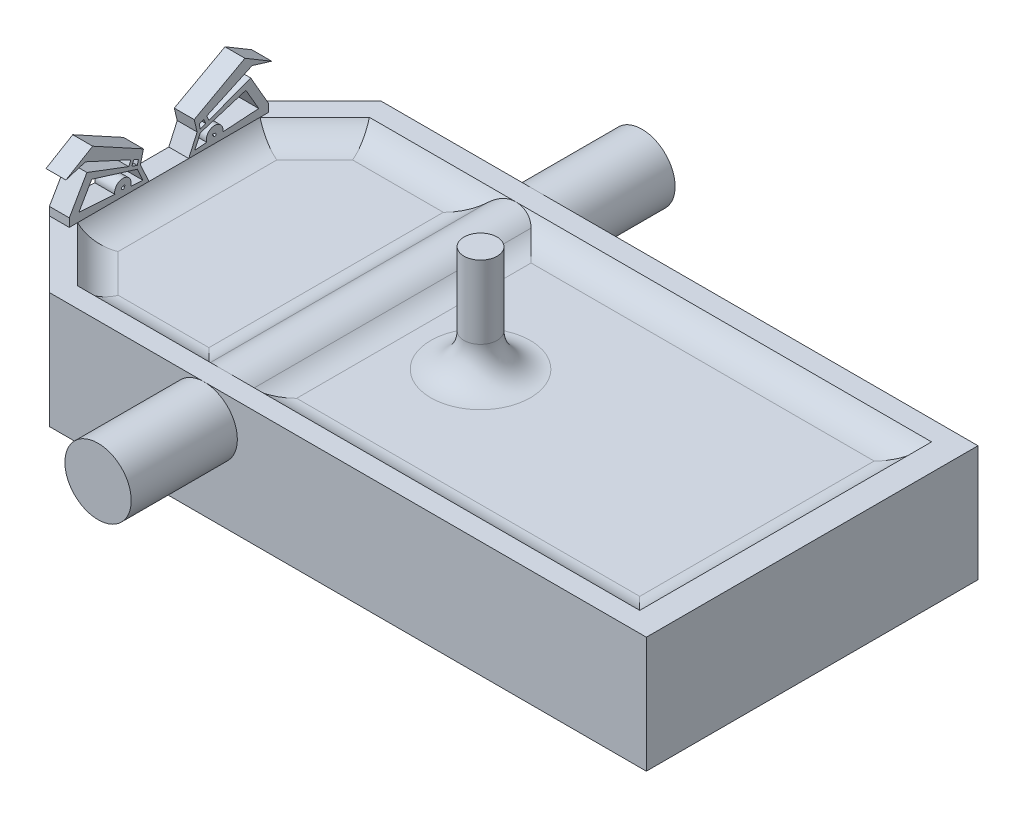
from build123d import *

# Parameters (mm, degrees)
SALIENTE_EXTRUIR1_DEPTH       = 5
CROQUIS2_R                    = 5
SALIENTE_EXTRUIR2_DEPTH       = 41
CROQUIS3_R                    = 2.5
SALIENTE_EXTRUIR3_DEPTH       = 16
SALIENTE_EXTRUIR10_DEPTH      = 10
SALIENTE_EXTRUIR10_DEPTH_BACK = 7.5
REDONDEO3_R                   = 5
SALIENTE_EXTRUIR11_DEPTH      = 3
CORTAR_EXTRUIR1_DEPTH         = 3


with BuildPart() as part:
    # Croquis1 → Saliente-Extruir1 (new body)
    with BuildSketch(Plane(origin=(0, 0, 0), x_dir=(1, 0, 0), z_dir=(0, 1, 0))):
        Polygon((-50, 15), (-40, 25), (50, 25), (50, -25), (-40, -25), (-50, -15), align=None)
    extrude(amount=SALIENTE_EXTRUIR1_DEPTH)

    # Croquis2 → Saliente-Extruir2 (add, symmetric)
    with BuildSketch(Plane.XY):
        with Locations((-16.666666667, 2.5)):
            Circle(CROQUIS2_R)
    extrude(amount=SALIENTE_EXTRUIR2_DEPTH, both=True)

    # Croquis3 → Saliente-Extruir3 (add)
    with BuildSketch(Plane(origin=(0, 5, 0), x_dir=(1, 0, 0), z_dir=(0, 1, 0))):
        with Locations(Location((0, 0, 0), (0, 0, 270))):
            Circle(CROQUIS3_R)
    extrude(amount=SALIENTE_EXTRUIR3_DEPTH)

    # Croquis24 → Saliente-Extruir10 (add, two sides: drawn at the far end of the back side and taken through both)
    with BuildSketch(Plane.XZ.offset(-SALIENTE_EXTRUIR10_DEPTH_BACK)):
        Polygon((50, 25), (-40, 25), (-50, 15), (-50, -15), (-40, -25), (50, -25), align=None)
        Polygon((46, 22), (-38.757359313, 22), (-47, 13.757359313), (-47, -13.757359313), (-38.757359313, -22), (46, -22), align=None, mode=Mode.SUBTRACT)
    extrude(amount=SALIENTE_EXTRUIR10_DEPTH + SALIENTE_EXTRUIR10_DEPTH_BACK)

    # Redondeo3
    # the kernel refuses this fillet: 5 mm, written as the material it adds along each edge
    with BuildSketch(Plane(origin=(46, 5, -22), x_dir=(0, 0, 1), z_dir=(-1, 0, 0)), Plane(origin=(-23.161857195, 5, 22), x_dir=(0, 0, -1), z_dir=(1, 0, 0))) as redondeo3_piece_1:
        with BuildLine():
            CenterArc((4.330127019, 5), REDONDEO3_R, 210, 60)
            Line((0, 2.5), (0, 0))
            Line((0, 0), (4.330127019, 0))
        make_face()
    extrude(amount=69.161857195)
    with BuildSketch(Plane(origin=(46, 5, 22), x_dir=(-1, 0, 0), z_dir=(0, 0, -1))) as redondeo3_piece_2:
        with BuildLine():
            CenterArc((4.330127019, 5), REDONDEO3_R, 210, 60)
            Line((0, 2.5), (0, 0))
            Line((0, 0), (4.330127019, 0))
        make_face()
    extrude(amount=44)
    with BuildSketch(Plane(origin=(-20.996793686, 5, -22), x_dir=(-1, 0, 0), z_dir=(0, 0, 1))) as redondeo3_piece_3:
        with BuildLine():
            CenterArc((2.284251259, -5), REDONDEO3_R, 90, 41.409622109)
            ThreePointArc((-1.02293788, -1.25), (-0.460660063, -0.66657946), (0, 0))
            Line((0, 0), (2.284251259, 0))
        make_face()
    extrude(amount=44)
    with BuildSketch(Plane(origin=(-12.336539648, 5, -22), x_dir=(-0.6333158920043388, 0.7738933911946454, 0), z_dir=(0, 0, 1))) as redondeo3_piece_4:
        with BuildLine():
            CenterArc((2.422814332, -4.934346413), REDONDEO3_R, 99.295188945, 41.409622109)
            Line((-1.446652623, -1.767766953), (0, 0))
            ThreePointArc((0, 0), (0.807604777, -0.065653587), (1.615209555, 0))
        make_face()
    extrude(amount=44)
    with BuildSketch(Plane(origin=(-49.58267686, 5, 22), x_dir=(0, 0, -1), z_dir=(1, 0, 0))) as redondeo3_piece_5_section:
        with BuildLine():
            CenterArc((4.330127019, 5), REDONDEO3_R, 210, 60)
            Line((0, 2.5), (0, 0))
            Line((0, 0), (4.330127019, 0))
        make_face()
    redondeo3_piece_5 = extrude(amount=39.411200722, mode=Mode.PRIVATE)
    redondeo3_piece_5 = split(redondeo3_piece_5, bisect_by=Plane(origin=(-35.229781416, 5.661212727, 25.527577897), z_dir=(0.7071067811865477, 0, -0.7071067811865475)), keep=Keep.TOP, mode=Mode.PRIVATE)
    add(redondeo3_piece_5)
    with BuildSketch(Plane(origin=(-54.654655446, 5, 6.102703867), x_dir=(0, 1, 0), z_dir=(0.7071067811865475, 0, 0.7071067811865477))) as redondeo3_piece_6_section:
        with BuildLine():
            CenterArc((5, -4.330127019), REDONDEO3_R, 120, 60)
            Line((0, -4.330127019), (0, 0))
            Line((0, 0), (2.5, 0))
        make_face()
    redondeo3_piece_6 = extrude(amount=33.307489344, mode=Mode.PRIVATE)
    redondeo3_piece_6 = split(redondeo3_piece_6, bisect_by=Plane(origin=(-47, 5.661212727, 16.588119965), z_dir=(1, 0, 0)), keep=Keep.TOP, mode=Mode.PRIVATE)
    redondeo3_piece_6 = split(redondeo3_piece_6, bisect_by=Plane(origin=(-41.588119965, 5.661212727, 22), z_dir=(0, 0, -1)), keep=Keep.TOP, mode=Mode.PRIVATE)
    add(redondeo3_piece_6)
    with BuildSketch(Plane(origin=(-47, 5, -24.58267686), x_dir=(1, 0, 0), z_dir=(0, 0, 1))) as redondeo3_piece_7_section:
        with BuildLine():
            CenterArc((4.330127019, 5), REDONDEO3_R, 210, 60)
            Line((0, 2.5), (0, 0))
            Line((0, 0), (4.330127019, 0))
        make_face()
    redondeo3_piece_7 = extrude(amount=49.16535372, mode=Mode.PRIVATE)
    redondeo3_piece_7 = split(redondeo3_piece_7, bisect_by=Plane(origin=(-52.966116147, 5.661212727, 7.791243166), z_dir=(0.7071067811865477, 0, -0.7071067811865475)), keep=Keep.TOP, mode=Mode.PRIVATE)
    redondeo3_piece_7 = split(redondeo3_piece_7, bisect_by=Plane(origin=(-52.966116147, 5.661212727, -7.791243166), z_dir=(0.7071067811865477, 0, 0.7071067811865474)), keep=Keep.TOP, mode=Mode.PRIVATE)
    add(redondeo3_piece_7)
    with BuildSketch(Plane(origin=(-31.102703867, 5, -29.654655446), x_dir=(0.7071067811865478, 0, 0.7071067811865474), z_dir=(-0.7071067811865474, 0, 0.7071067811865477))) as redondeo3_piece_8_section:
        with BuildLine():
            CenterArc((4.330127019, 5), REDONDEO3_R, 210, 60)
            Line((0, 2.5), (0, 0))
            Line((0, 0), (4.330127019, 0))
        make_face()
    redondeo3_piece_8 = extrude(amount=33.307489344, mode=Mode.PRIVATE)
    redondeo3_piece_8 = split(redondeo3_piece_8, bisect_by=Plane(origin=(-47, 5.661212727, -16.588119965), z_dir=(1, 0, 0)), keep=Keep.TOP, mode=Mode.PRIVATE)
    redondeo3_piece_8 = split(redondeo3_piece_8, bisect_by=Plane(origin=(-41.588119965, 5.661212727, -22), z_dir=(0, 0, 1)), keep=Keep.TOP, mode=Mode.PRIVATE)
    add(redondeo3_piece_8)
    with BuildSketch(Plane(origin=(-10.171476138, 5, -22), x_dir=(0, 0, 1), z_dir=(-1, 0, 0))) as redondeo3_piece_9_section:
        with BuildLine():
            CenterArc((4.330127019, 5), REDONDEO3_R, 210, 60)
            Line((0, 2.5), (0, 0))
            Line((0, 0), (4.330127019, 0))
        make_face()
    redondeo3_piece_9 = extrude(amount=39.411200722, mode=Mode.PRIVATE)
    redondeo3_piece_9 = split(redondeo3_piece_9, bisect_by=Plane(origin=(-26.735758427, 5.066113157, -34.021600886), z_dir=(0.7071067811865477, 0, 0.7071067811865474)), keep=Keep.TOP, mode=Mode.PRIVATE)
    add(redondeo3_piece_9)
    with BuildSketch(Plane(origin=(0, 5, 0), x_dir=(0, 0, 1), z_dir=(-1, 0, 0))) as redondeo3_piece_10:
        with BuildLine():
            CenterArc((2.5 + REDONDEO3_R, REDONDEO3_R), REDONDEO3_R, 180, 90)
            Line((2.5, REDONDEO3_R), (2.5, 0))
            Line((2.5, 0), (2.5 + REDONDEO3_R, 0))
        make_face()
    revolve(axis=Axis((0, 5, 0), (0, 1, 0)))

    # Croquis25 → Saliente-Extruir11 (add)
    # profile 1 of 2: a face of its own
    with BuildSketch(Plane.ZY.offset(50)):
        Polygon((-3, 7.5), (-4.271961203, 10.321467355), (-3.825834184, 12.171467355), (-11.478733088, 16.349678992), (-15.514093965, 13.949275268), (-12.566054552, 14.849678992), (-5.713025242, 11.692794832), (-6.047742661, 10.966183347), (-12.344374095, 13.349678992), (-15, 8.75), (-15, 7.5), align=None)
        Polygon((-5.258893064, 11.483596445), (-4.581316792, 11.171467355), (-4.749343557, 10.474693788), (-5.578981907, 10.788740976), align=None, mode=Mode.SUBTRACT)
        with BuildLine():
            Line((-13.556624327, 8.75), (-11.622686259, 12.099678992))
            Line((-11.622686259, 12.099678992), (-4.749343557, 9.974693788))
            Line((-4.749343557, 9.974693788), (-3.915472936, 8.125))
            Line((-3.915472936, 8.125), (-5.723760223, 8.242224542))
            ThreePointArc((-5.723760223, 8.242224542), (-6.834609816, 9.866860567), (-8.145918644, 8.399244067))
            Line((-8.145918644, 8.399244067), (-13.556624327, 8.75))
        make_face(mode=Mode.SUBTRACT)
        with BuildLine():
            ThreePointArc((-6.85573604, 8.822987446), (-7.052684855, 8.457747166), (-6.724418166, 8.711578367))
            add(Edge.make_bspline(
                [(-6.724418166, 8.711578367), (-6.676833807, 8.722274165), (-6.55662927, 8.681929546), (-6.577709986, 8.898272332), (-6.753765056, 8.872588077), (-6.835537659, 8.837673257), (-6.85573604, 8.822987446)],
                knots=[0, 0, 0, 0, 0.159221348, 0.274521525, 0.50339388, 0.587777767, 0.587777767, 0.587777767, 0.587777767], degree=3))
        make_face(mode=Mode.SUBTRACT)
    # profile 2 of 2: a face of its own
    with BuildSketch(Plane.ZY.offset(50)):
        Polygon((15, 7.5), (3, 7.5), (4.271961203, 10.321467355), (3.825834184, 12.171467355), (11.478733088, 16.349678992), (15.514093965, 13.949275268), (12.566054552, 14.849678992), (5.713025242, 11.692794832), (6.047742661, 10.966183347), (12.344374095, 13.349678992), (15, 8.75), align=None)
        Polygon((5.258893064, 11.483596445), (4.581316792, 11.171467355), (4.749343557, 10.474693788), (5.578981907, 10.788740976), align=None, mode=Mode.SUBTRACT)
        with BuildLine():
            Line((3.915472936, 8.125), (5.723760223, 8.242224542))
            ThreePointArc((5.723760223, 8.242224542), (6.834609816, 9.866860567), (8.145918644, 8.399244067))
            Line((8.145918644, 8.399244067), (13.556624327, 8.75))
            Line((13.556624327, 8.75), (11.622686259, 12.099678992))
            Line((11.622686259, 12.099678992), (4.749343557, 9.974693788))
            Line((4.749343557, 9.974693788), (3.915472936, 8.125))
        make_face(mode=Mode.SUBTRACT)
        with BuildLine():
            ThreePointArc((6.85573604, 8.822987446), (7.052684855, 8.457747166), (6.724418166, 8.711578367))
            add(Edge.make_bspline(
                [(6.724418166, 8.711578367), (6.676833807, 8.722274165), (6.55662927, 8.681929546), (6.577709986, 8.898272332), (6.753765056, 8.872588077), (6.835537659, 8.837673257), (6.85573604, 8.822987446)],
                knots=[0, 0, 0, 0, 0.159221348, 0.274521525, 0.50339388, 0.587777767, 0.587777767, 0.587777767, 0.587777767], degree=3))
        make_face(mode=Mode.SUBTRACT)
    extrude(amount=-SALIENTE_EXTRUIR11_DEPTH)

    # Croquis26 → Cortar-Extruir1 (cut)
    with BuildSketch(Plane.ZY.offset(50)):
        Polygon((-6.45713592, -2), (6.45713592, -2), (8.212311407, -0.1), (5.95713592, -0.6), (-5.95713592, -0.6), (-8.212311407, -0.1), align=None)
        Polygon((-0.875, 3.515544457), (0.875, 3.515544457), (0, 2), align=None)
    extrude(amount=-CORTAR_EXTRUIR1_DEPTH, mode=Mode.SUBTRACT)


solid = part.part
